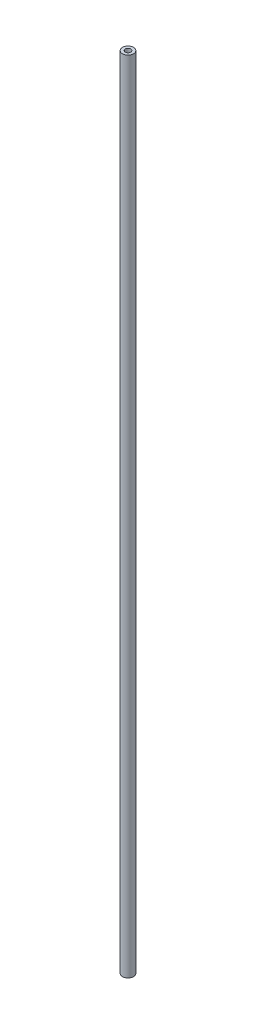
from build123d import *

# Parameters (mm, degrees)
SKETCH1_R           = 6.35
SKETCH1_R_2         = 3.175
BOSS_EXTRUDE1_DEPTH = 914.4


with BuildPart() as part:
    # Sketch1 → Boss-Extrude1 (new body)
    with BuildSketch(Plane(origin=(0, 0, 0), x_dir=(1, 0, 0), z_dir=(0, 1, 0))):
        Circle(SKETCH1_R)
        Circle(SKETCH1_R_2, mode=Mode.SUBTRACT)
    extrude(amount=BOSS_EXTRUDE1_DEPTH)


solid = part.part
